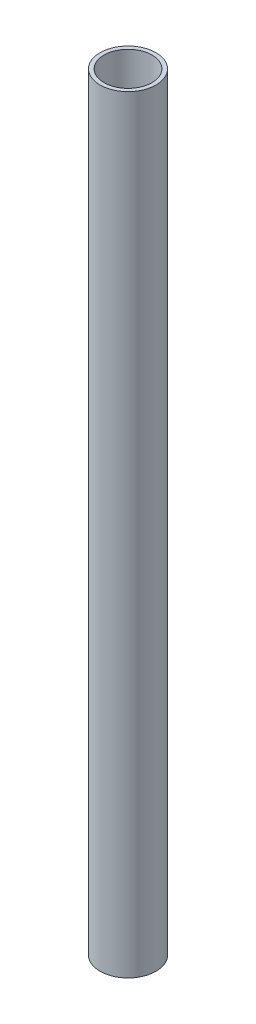
from build123d import *

# Parameters (mm, degrees)
SKETCH1_R           = 44.45
SKETCH1_R_2         = 38.1
BOSS_EXTRUDE1_DEPTH = 609.6


with BuildPart() as part:
    # Sketch1 → Boss-Extrude1 (new, symmetric)
    with BuildSketch(Plane(origin=(0, 0, 0), x_dir=(1, 0, 0), z_dir=(0, 1, 0))):
        Circle(SKETCH1_R)
        Circle(SKETCH1_R_2, mode=Mode.SUBTRACT)
    extrude(amount=BOSS_EXTRUDE1_DEPTH, both=True)


solid = part.part
